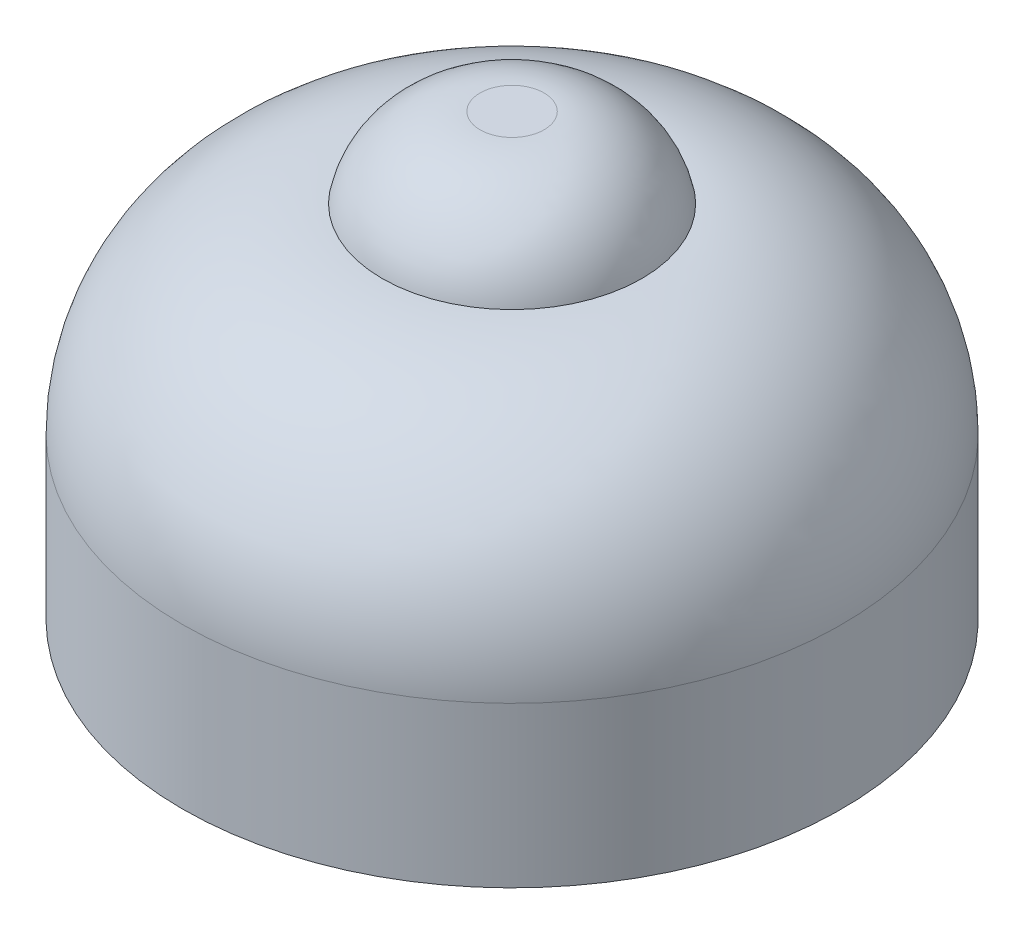
from build123d import *

# Parameters (mm, degrees)
SKETCH1_R           = 16.5
BOSS_EXTRUDE1_DEPTH = 18
FILLET1_R           = 10
SKETCH2_R           = 6.5
BOSS_EXTRUDE2_DEPTH = 4
FILLET5_R           = 5


with BuildPart() as part:
    # Sketch1 → Boss-Extrude1 (new body)
    with BuildSketch(Plane(origin=(0, 0, 0), x_dir=(1, 0, 0), z_dir=(0, 1, 0))):
        with Locations(Location((0, 0, 0), (0, 0, 270))):
            Circle(SKETCH1_R)
    extrude(amount=BOSS_EXTRUDE1_DEPTH)

    # Fillet1
    fillet1_edges = [part.edges().sort_by_distance(p)[0] for p in [
        (0, 18, -16.5),
    ]]
    fillet(fillet1_edges, radius=FILLET1_R)

    # Sketch2 → Boss-Extrude2 (add)
    with BuildSketch(Plane(origin=(0, 18, 0), x_dir=(1, 0, 0), z_dir=(0, 1, 0))):
        with Locations(Location((0, 0, 0), (0, 0, 270))):
            Circle(SKETCH2_R)
    extrude(amount=BOSS_EXTRUDE2_DEPTH)

    # Fillet5
    # the kernel refuses this fillet: 5 mm, written as the material it takes off along each edge
    with BuildSketch(Plane(origin=(0, 22, 0), x_dir=(0, 0, 1), z_dir=(-1, 0, 0))) as fillet5_piece_1:
        with BuildLine():
            CenterArc((1.601020514, -5), FILLET5_R, 11.536959033, 78.463040967)
            Line((1.601020514, 0), (1.601020514, 0.1))
            Line((1.601020514, 0.1), (6.5, 0.1))
            Line((6.5, 0.1), (6.6, 0))
            ThreePointArc((6.6, 0), (6.6, -2), (6.59797959, -3.98))
            Line((6.59797959, -3.98), (6.5, -4))
        make_face()
    revolve(axis=Axis((0, 22, 0), (0, 1, 0)), mode=Mode.SUBTRACT)


solid = part.part
